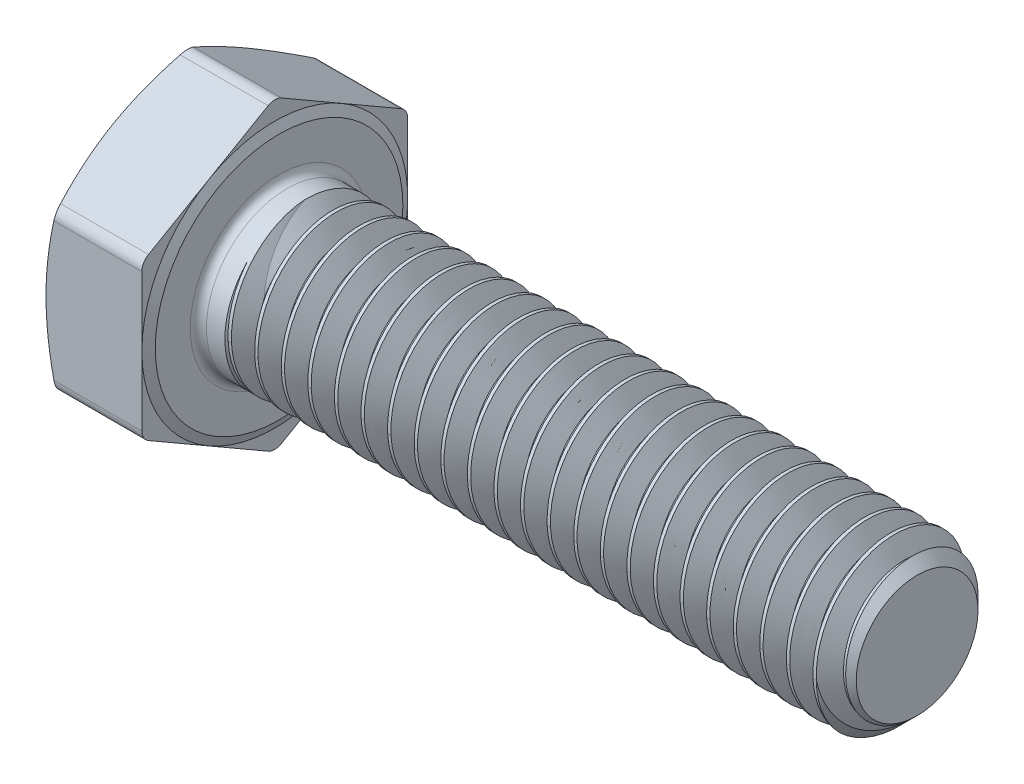
from build123d import *

# Parameters (mm, degrees)
SKETCH2_R                = 2.413
BOSS_EXTRUDE1_DEPTH      = 19.05
BOSS_EXTRUDE2_DEPTH      = 3.175
SKETCH5_OUTSIDE_W        = 28.62
SKETCH5_OUTSIDE_H        = 29.848
SKETCH5_OUTSIDE_R        = 3.571875
CUT_EXTRUDE1_DEPTH       = 3.175
CUT_EXTRUDE1_DRAFT       = -65
BOSS_EXTRUDE5_DEPTH      = 0.0635
FILLET5_R                = 0.0635
CIRPATTERN1_COUNT        = 6
FILLET5_OF_CIRPATTERN1_R = 0.0635
FILLET7_R                = 0.396875
CHAMFER1_SIZE            = 0.5953125
FILLET4_R                = 0.2413
CUT_SWEEP1_PITCH         = 0.79375
CUT_SWEEP1_TO            = 18.25625


with BuildPart() as part:
    # Sketch2 → Boss-Extrude1 (new body)
    with BuildSketch(Plane(origin=(0, 0, 0), x_dir=(0, 0, -1), z_dir=(1, 0, 0))):
        with Locations(Location((0, 0, 0), (0, 0, 180))):
            Circle(SKETCH2_R)
    extrude(amount=BOSS_EXTRUDE1_DEPTH)

    # Sketch3 → Boss-Extrude2 (add)
    with BuildSketch(Plane.ZY):
        Polygon((0, 4.582717762), (-3.96875, 2.291358881), (-3.96875, -2.291358881), (0, -4.582717762), (3.96875, -2.291358881), (3.96875, 2.291358881), align=None)
    extrude(amount=BOSS_EXTRUDE2_DEPTH)


with BuildPart() as cut_extrude1_tool:
    # Sketch5 outside → Cut-Extrude1 (with draft: the straight prism first)
    with BuildSketch(Plane.ZY.offset(3.175)):
        Rectangle(SKETCH5_OUTSIDE_W, SKETCH5_OUTSIDE_H)
        Circle(SKETCH5_OUTSIDE_R, mode=Mode.SUBTRACT)
    extrude(amount=-CUT_EXTRUDE1_DEPTH)
    # Cut-Extrude1: the draft: its side faces are tilted about the plane it starts from
    cut_extrude1_sides = [cut_extrude1_tool.faces().sort_by_distance(p)[0] for p in [
        (-1.5875, -14.924, 0),
        (-1.5875, 0, 14.31),
        (-1.5875, 14.924, 0),
        (-1.5875, 0, -14.31),
        (-1.5875, 0, -3.571875),
    ]]
    draft(cut_extrude1_sides, Plane.ZY.offset(3.175), CUT_EXTRUDE1_DRAFT)


with BuildPart() as part_1:
    add(part.part)

    # Cut-Extrude1: cut by cut_extrude1_tool
    add(cut_extrude1_tool.part, mode=Mode.SUBTRACT)

    # Sketch11 → Boss-Extrude5 (add)
    with BuildSketch(Plane.ZY.offset(3.175)):
        with BuildLine():
            Line((0.15875, 2.8178125), (0.15875, 1.74625))
            ThreePointArc((0.15875, 1.74625), (0, 1.5875), (-0.15875, 1.74625))
            Line((-0.15875, 1.74625), (-0.15875, 2.8178125))
            ThreePointArc((-0.15875, 2.8178125), (0, 2.9765625), (0.15875, 2.8178125))
        make_face()
    boss_extrude5 = extrude(amount=BOSS_EXTRUDE5_DEPTH)

    # Fillet5
    fillet5_edges = [part_1.edges().sort_by_distance(p)[0] for p in [
        (-3.2385, 2.28203125, 0.15875),
        (-3.2385, 1.5875, 0),
        (-3.2385, 2.28203125, -0.15875),
        (-3.2385, 2.9765625, 0),
    ]]
    fillet(fillet5_edges, radius=FILLET5_R - 0.0001)  # a hair under: the kernel refuses the full size

    # CirPattern1: Boss-Extrude5 ×6 about axis
    cirpattern1_axis = Axis((0, 0, 0), (1, 0, 0))
    for i in range(1, CIRPATTERN1_COUNT):
        add(boss_extrude5.rotate(cirpattern1_axis, i * 360 / CIRPATTERN1_COUNT))

    # Fillet5 of CirPattern1
    fillet5_of_cirpattern1_edges = [part_1.edges().sort_by_distance(p)[0] for p in [
        (-3.2385, 1.003534092, 2.055672035),
        (-3.2385, 0.79375, 1.374815329),
        (-3.2385, 1.278497158, 1.896922035),
        (-3.2385, 1.48828125, 2.577778741),
        (-3.2385, -1.278497158, 1.896922035),
        (-3.2385, -0.79375, 1.374815329),
        (-3.2385, -1.003534092, 2.055672035),
        (-3.2385, -1.48828125, 2.577778741),
        (-3.2385, -2.28203125, -0.15875),
        (-3.2385, -1.5875, 0),
        (-3.2385, -2.28203125, 0.15875),
        (-3.2385, -2.9765625, 0),
        (-3.2385, -1.003534092, -2.055672035),
        (-3.2385, -0.79375, -1.374815329),
        (-3.2385, -1.278497158, -1.896922035),
        (-3.2385, -1.48828125, -2.577778741),
        (-3.2385, 1.278497158, -1.896922035),
        (-3.2385, 0.79375, -1.374815329),
        (-3.2385, 1.003534092, -2.055672035),
        (-3.2385, 1.48828125, -2.577778741),
    ]]
    fillet(fillet5_of_cirpattern1_edges, radius=FILLET5_OF_CIRPATTERN1_R - 0.0001)  # a hair under: the kernel refuses the full size

    # Fillet7
    fillet7_edges = [part_1.edges().sort_by_distance(p)[0] for p in [
        (-1.35181814, -4.582717762, 0),
        (-1.35181814, -2.291358881, -3.96875),
        (-1.35181814, 2.291358881, -3.96875),
        (-1.35181814, 4.582717762, 0),
        (-1.35181814, -2.291358881, 3.96875),
        (-1.35181814, 2.291358881, 3.96875),
    ]]
    fillet(fillet7_edges, radius=FILLET7_R)

    # Chamfer1
    chamfer1_edges = [part_1.edges().sort_by_distance(p)[0] for p in [
        (19.05, 0, -2.413),
    ]]
    chamfer(chamfer1_edges, length=CHAMFER1_SIZE)

    # Sketch15 → Cut-Revolve1 (revolve, cut)
    with BuildSketch(Plane.XY, mode=Mode.PRIVATE) as cut_revolve1_sk:
        Polygon((0, 3.696397621), (-0.127, 3.96875), (-0.127, 4.582717762), (0, 4.582717762), align=None)
    revolve(cut_revolve1_sk.sketch.rotate(Axis((0, 0, 0), (-1, 0, 0)), 210), axis=Axis((0, 0, 0), (-1, 0, 0)), mode=Mode.SUBTRACT)

    # Fillet4
    fillet4_edges = [part_1.edges().sort_by_distance(p)[0] for p in [
        (0, 0, -2.413),
    ]]
    fillet(fillet4_edges, radius=FILLET4_R)


with BuildPart() as body_2:
    # Split1: the piece on the far side of the plane
    add(part_1.part)
    split(bisect_by=Plane(origin=(0.79375, 0, 0), x_dir=(0, 0, 1), z_dir=(1, 0, 0)), keep=Keep.BOTTOM)


with BuildPart() as part_2:
    add(part_1.part)

    # Split1
    split(bisect_by=Plane(origin=(0.79375, 0, 0), x_dir=(0, 0, 1), z_dir=(1, 0, 0)), keep=Keep.TOP)

    # Cut-Sweep1: arcs per turn and ends read off the stored shape
    # Cut-Sweep1: the profile of Sketch13 profile screwed along a right-hand helix through 25 turns, 8 arcs to a turn; built about Z, then put on its axis
    cut_sweep1_z = Axis((0, 0, 0), (0, 0, 1))
    cut_sweep1_corners = [(2.4133, 0, 0.000173205), (2.4133, 0, -0.694704455), (1.897444252, 0, -0.396875), (1.897444252, 0, -0.29765625)]
    with BuildLine(mode=Mode.PRIVATE) as cut_sweep1_profile:
        Line(cut_sweep1_corners[0], cut_sweep1_corners[1])
        Line(cut_sweep1_corners[1], cut_sweep1_corners[2])
        Line(cut_sweep1_corners[2], cut_sweep1_corners[3])
        Line(cut_sweep1_corners[3], cut_sweep1_corners[0])
    cut_sweep1_cap = Face(cut_sweep1_profile.wire())
    cut_sweep1_turn_angles = [0, 22.5, 45, 67.5, 90, 112.5, 135, 157.5, 180, 202.5, 225, 247.5, 270, 292.5, 315, 337.5, 360]
    cut_sweep1_turn_weights = [1, 0.9238795325112867, 1, 0.9238795325112867, 1, 0.9238795325112867, 1, 0.9238795325112867, 1, 0.9238795325112867, 1, 0.9238795325112867, 1, 0.9238795325112867, 1, 0.9238795325112867, 1]
    cut_sweep1_turn_rails = [Edge.make_bspline([Vector(p[0], p[1], 0).rotate(cut_sweep1_z, cut_sweep1_turn_angles[k]) / cut_sweep1_turn_weights[k] + Vector(0, 0, p[2] + CUT_SWEEP1_PITCH * cut_sweep1_turn_angles[k] / 360) for k in range(17)], [0, 0, 0, 1, 1, 2, 2, 3, 3, 4, 4, 5, 5, 6, 6, 7, 7, 8, 8, 8], 2, cut_sweep1_turn_weights) for p in cut_sweep1_corners]
    cut_sweep1_turn_sides = [Face.make_surface_from_curves(cut_sweep1_turn_rails[p[0]], cut_sweep1_turn_rails[p[1]]) for p in [(0, 1), (1, 2), (2, 3), (3, 0)]]
    cut_sweep1 = Plane(origin=(19.05, 0, 0), x_dir=(0, 1, 0), z_dir=(-1, 0, 0)) * split(Solid(Shell([*[p.moved(Location((0, 0, CUT_SWEEP1_PITCH * i))) for i in range(25) for p in cut_sweep1_turn_sides], cut_sweep1_cap, cut_sweep1_cap.rotate(cut_sweep1_z, 9000).moved(Location((0, 0, CUT_SWEEP1_PITCH * 9000 / 360)))])), bisect_by=Plane.XY.offset(CUT_SWEEP1_TO), keep=Keep.BOTTOM, mode=Mode.PRIVATE)
    add(cut_sweep1, mode=Mode.SUBTRACT)


with BuildPart() as boss_extrude4_tool:
    # Boss-Extrude4: read off the stored shape, not the designer's step
    # Boss-Extrude4 outline → Boss-Extrude4 (revolve)
    with BuildSketch(Plane.YX):
        Polygon((2.413, 0.79375), (1.897435298, 1.226360151), (1.897435298, 0.79375), align=None)
    revolve(axis=Axis((0, 0, 0), (1, 0, 0)))


with BuildPart() as part_3:
    add(part_2.part)


with BuildPart() as part_4:
    # Boss-Extrude4: joined with boss_extrude4_tool
    add(part_3.part.fuse(boss_extrude4_tool.part, body_2.part, tol=0.00001))


solid = part_4.part
